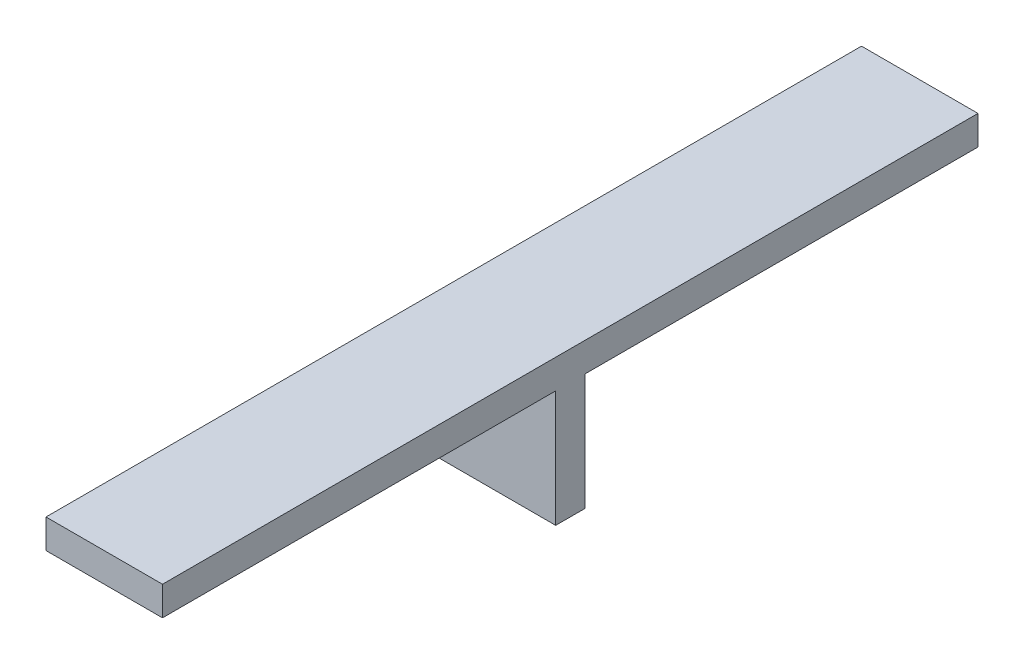
from build123d import *

# Parameters (mm, degrees)
SKETCH1_W           = 25.4
SKETCH1_H           = 177.8
BOSS_EXTRUDE1_DEPTH = 6.35
SKETCH2_W           = 25.4
SKETCH2_H           = 6.35
BOSS_EXTRUDE2_DEPTH = 25.4


with BuildPart() as part:
    # Sketch1 → Boss-Extrude1 (new body)
    with BuildSketch(Plane(origin=(0, 0, 0), x_dir=(1, 0, 0), z_dir=(0, 1, 0))):
        Rectangle(SKETCH1_W, SKETCH1_H)
    extrude(amount=BOSS_EXTRUDE1_DEPTH)

    # Sketch2 → Boss-Extrude2 (add)
    with BuildSketch(Plane(origin=(0, 0, 0), x_dir=(-1, 0, 0), z_dir=(0, -1, 0))):
        Rectangle(SKETCH2_W, SKETCH2_H)
    extrude(amount=BOSS_EXTRUDE2_DEPTH)


solid = part.part
